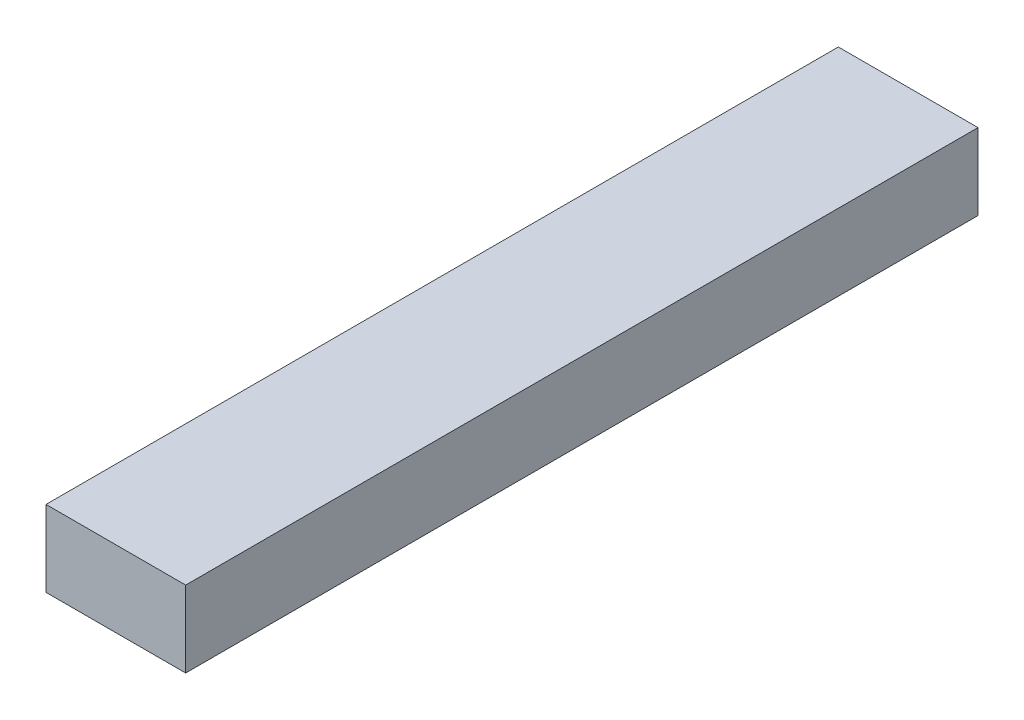
from build123d import *

# Parameters (mm, degrees)
SKETCH_1_W      = 55
SKETCH_1_H      = 312
EXTRUDE_1_DEPTH = 30


with BuildPart() as part:
    # Эскиз1 → Бобышка-Вытянуть1 (new body)
    with BuildSketch(Plane(origin=(0, 0, 0), x_dir=(1, 0, 0), z_dir=(0, 1, 0))):
        with Locations((27.5, 156)):
            Rectangle(SKETCH_1_W, SKETCH_1_H)
    extrude(amount=EXTRUDE_1_DEPTH)


solid = part.part
